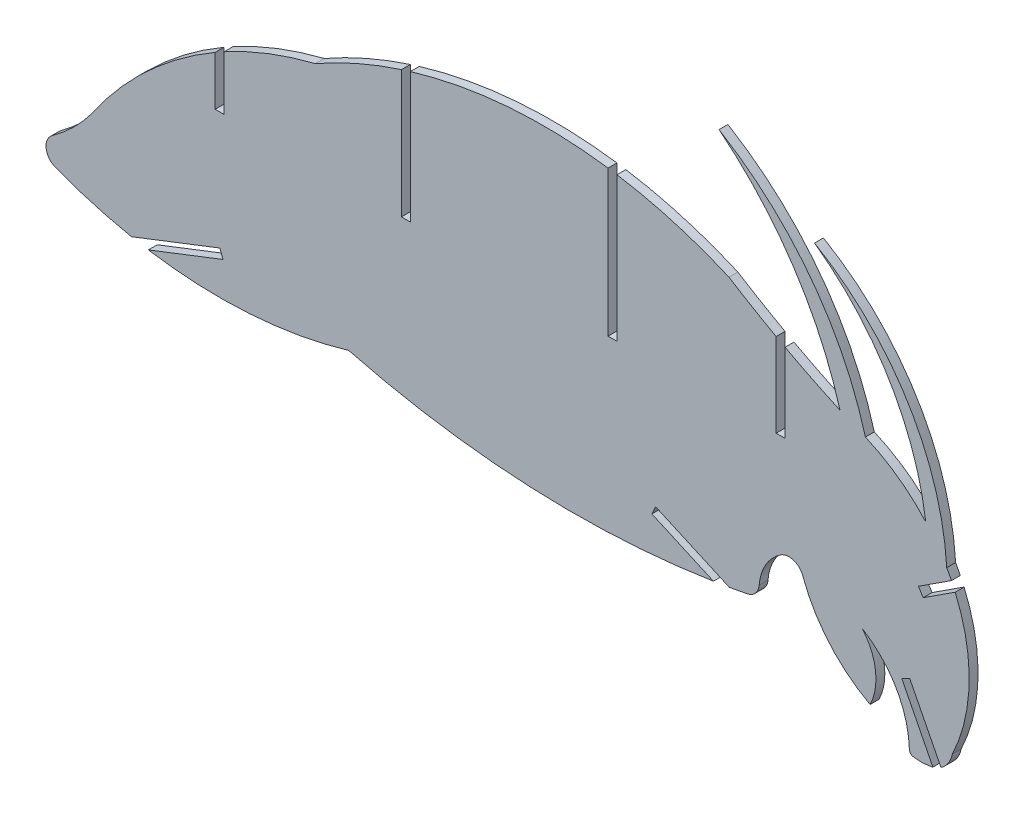
from build123d import *

# Parameters (mm, degrees)
BASE_FLANGE1_DEPTH = 1.524


# Sheet-metal steps are written as plain solids
with BuildPart() as part:
    # Sketch1 → Base-Flange1 (new body)
    with BuildSketch(Plane.XY):
        with BuildLine():
            Line((231.694733782, 24.263932463), (226.322343195, 34.826415896))
            Line((226.322343195, 34.826415896), (224.963957286, 34.135500761))
            Line((224.963957286, 34.135500761), (230.310366707, 23.62409806))
            ThreePointArc((230.310366707, 23.62409806), (229.903279587, 23.531939933), (229.489552508, 23.476777012))
            ThreePointArc((229.489552508, 23.476777012), (228.197526273, 23.373669283), (226.906388141, 23.487358857))
            ThreePointArc((226.906388141, 23.487358857), (226.4596517, 23.740258206), (226.274712745, 24.219141398))
            ThreePointArc((226.274712745, 24.219141398), (224.015809297, 32.216773888), (218.195630565, 38.14891429))
            ThreePointArc((218.195630565, 38.14891429), (220.465583992, 33.0404298), (219.538231847, 27.527778863))
            ThreePointArc((219.538231847, 27.527778863), (216.207783845, 29.677782654), (213.263726879, 32.332387856))
            ThreePointArc((213.263726879, 32.332387856), (210.198099549, 36.324777472), (208.004537358, 40.855288557))
            ThreePointArc((208.004537358, 40.855288557), (206.39770053, 42.404093827), (204.188624103, 42.08675537))
            ThreePointArc((204.188624103, 42.08675537), (201.624892341, 39.331988443), (200.505863828, 35.739045838))
            ThreePointArc((200.505863828, 35.739045838), (199.871363088, 34.249097505), (198.465439283, 33.445408832))
            ThreePointArc((198.465439283, 33.445408832), (196.924665159, 33.149450023), (195.38095855, 32.869188678))
            Line((195.38095855, 32.869188678), (182.741679906, 38.523729549))
            Line((182.741679906, 38.523729549), (182.119318407, 37.132599733))
            Line((182.119318407, 37.132599733), (192.663920738, 32.415171901))
            ThreePointArc((192.663920738, 32.415171901), (161.242789348, 30.704605569), (130.128998565, 35.41051229))
            ThreePointArc((130.128998565, 35.41051229), (113.063651794, 32.366088022), (95.747230087, 33.163658602))
            Line((95.747230087, 33.163658602), (108.559818137, 38.14891429))
            Line((108.559818137, 38.14891429), (108.007201374, 39.569192683))
            Line((108.007201374, 39.569192683), (92.863162197, 33.67679162))
            ThreePointArc((92.863162197, 33.67679162), (86.261009295, 35.281159538), (79.823408008, 37.453648673))
            ThreePointArc((79.823408008, 37.453648673), (78.22024482, 39.499195708), (79.254639852, 41.883398257))
            ThreePointArc((79.254639852, 41.883398257), (82.921318742, 44.978245875), (86.072618329, 48.596522643))
            ThreePointArc((86.072618329, 48.596522643), (95.542941515, 59.597739927), (107.212145233, 68.231596978))
            Line((107.212145233, 68.231596978), (107.212145233, 59.777231813))
            Line((107.212145233, 59.777231813), (108.736145233, 59.777231813))
            Line((108.736145233, 59.777231813), (108.736145233, 69.088203695))
            ThreePointArc((108.736145233, 69.088203695), (116.359031122, 72.623035129), (124.373136037, 75.148415287))
            ThreePointArc((124.373136037, 75.148415287), (131.602965043, 78.776561047), (139.163891612, 81.651671224))
            Line((139.163891612, 81.651671224), (139.163891612, 59.777231813))
            Line((139.163891612, 59.777231813), (140.687891612, 59.777231813))
            Line((140.687891612, 59.777231813), (140.687891612, 82.127226165))
            ThreePointArc((140.687891612, 82.127226165), (157.500365841, 85.268581792), (174.595729834, 84.743286803))
            Line((174.595729834, 84.743286803), (174.595729834, 59.777231813))
            Line((174.595729834, 59.777231813), (176.119729834, 59.777231813))
            Line((176.119729834, 59.777231813), (176.119729834, 84.515885394))
            ThreePointArc((176.119729834, 84.515885394), (185.904383104, 82.318759277), (195.334831423, 78.907975308))
            ThreePointArc((195.334831423, 78.907975308), (199.345089693, 76.463216465), (203.426624103, 74.139406221))
            Line((203.426624103, 74.139406221), (203.426624103, 59.777231813))
            Line((203.426624103, 59.777231813), (204.950624103, 59.777231813))
            Line((204.950624103, 59.777231813), (204.950624103, 73.312546377))
            ThreePointArc((204.950624103, 73.312546377), (209.623865484, 70.909977098), (214.374828712, 68.665011052))
            ThreePointArc((214.374828712, 68.665011052), (206.4297978, 85.930083199), (193.631366333, 99.980221435))
            ThreePointArc((193.631366333, 99.980221435), (209.362770136, 85.826652744), (218.735162472, 66.854071628))
            ThreePointArc((218.735162472, 66.854071628), (224.318551803, 63.708956455), (229.084465035, 59.425026374))
            ThreePointArc((229.084465035, 59.425026374), (222.842822588, 77.340987602), (210.010472895, 91.314912193))
            ThreePointArc((210.010472895, 91.314912193), (225.977718367, 75.717609631), (232.680835608, 54.426837112))
            ThreePointArc((232.680835608, 54.426837112), (233.094865862, 53.67572934), (233.486730489, 52.912823022))
            Line((233.486730489, 52.912823022), (227.814771071, 49.235924899))
            Line((227.814771071, 49.235924899), (228.643767466, 47.957120387))
            Line((228.643767466, 47.957120387), (234.133478106, 51.515874121))
            ThreePointArc((234.133478106, 51.515874121), (236.523898696, 39.310516196), (233.635048327, 27.213433234))
            ThreePointArc((233.635048327, 27.213433234), (232.956717504, 25.546706257), (231.694733782, 24.263932463))
        make_face()
    extrude(amount=-BASE_FLANGE1_DEPTH)


solid = part.part
